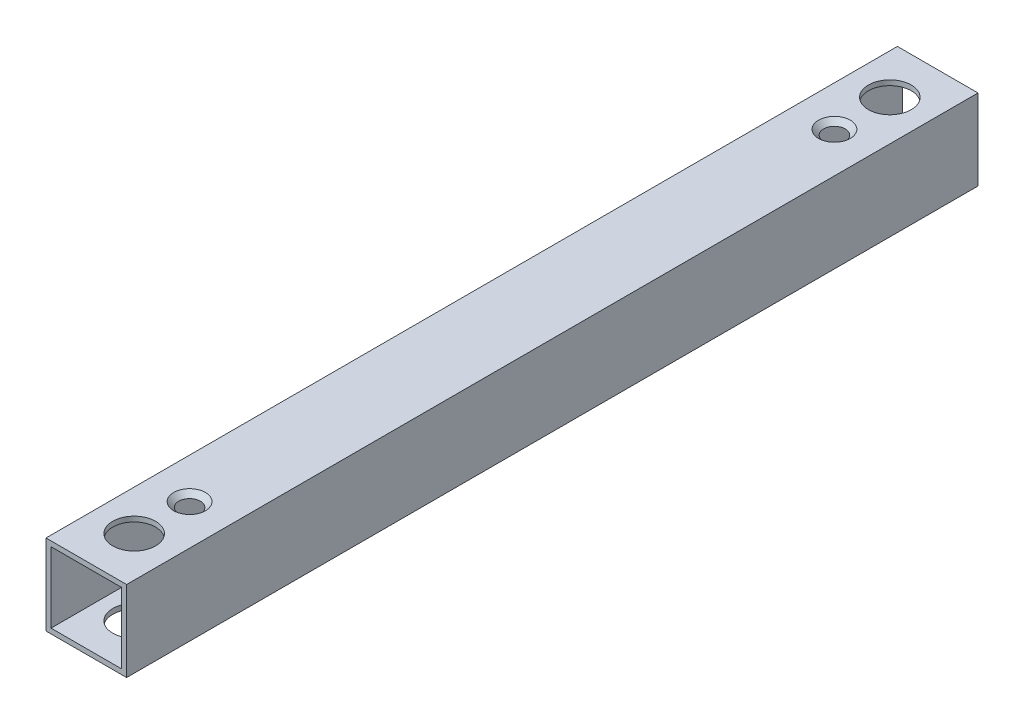
from build123d import *

# Parameters (mm, degrees)
SKETCH1_W           = 16
SKETCH1_H           = 16
SKETCH1_W_2         = 14
SKETCH1_H_2         = 14
BOSS_EXTRUDE1_DEPTH = 169
SKETCH2_R           = 4.25
SKETCH2_R_2         = 1.5
CUT_EXTRUDE1_DEPTH  = 170.944108459


# Read off the part's stored shape, not the designer's step: CSK for M3 Flat Head Machine Screw1
with BuildPart() as part:
    # Sketch1 → Boss-Extrude1 (new body)
    with BuildSketch(Plane.XY):
        Rectangle(SKETCH1_W, SKETCH1_H)
        Rectangle(SKETCH1_W_2, SKETCH1_H_2, mode=Mode.SUBTRACT)
    extrude(amount=-BOSS_EXTRUDE1_DEPTH)

    # Sketch2 → Cut-Extrude1 (cut, through all)
    with BuildSketch(Plane(origin=(0, 8, 0), x_dir=(1, 0, 0), z_dir=(0, 1, 0))):
        with Locations(Location((0, 159.5, 0), (0, 0, 270))):
            Circle(SKETCH2_R)
        with Locations(Location((0, 9.5, 0), (0, 0, 270))):
            Circle(SKETCH2_R)
        with Locations(Location((0, 20.5, 0), (0, 0, 270))):
            Circle(SKETCH2_R_2)
        with Locations(Location((0, 148.5, 0), (0, 0, 270))):
            Circle(SKETCH2_R_2)
    extrude(amount=-CUT_EXTRUDE1_DEPTH, mode=Mode.SUBTRACT)

    # CSK for M3 Flat Head Machine Screw1 outl → CSK for M3 Flat Head Machine Screw1 (revolve, cut)
    with BuildSketch(Plane.XY.offset(-148.5)):
        Polygon((1.5, -8), (3.15, -8), (2.15, -7), (1.5, -7), align=None)
        Polygon((3.15, 8), (1.5, 8), (1.5, 7), (2.15, 7), align=None)
    revolve(axis=Axis((0, 0, -148.5), (0, 1, 0)), mode=Mode.SUBTRACT)

    # CSK for M3 Flat Head Machine Screw1 2 ou → CSK for M3 Flat Head Machine Screw1 2 (revolve, cut)
    with BuildSketch(Plane.XY.offset(-20.5)):
        Polygon((1.5, -8), (3.15, -8), (2.15, -7), (1.5, -7), align=None)
        Polygon((3.15, 8), (1.5, 8), (1.5, 7), (2.15, 7), align=None)
    revolve(axis=Axis((0, 0, -20.5), (0, 1, 0)), mode=Mode.SUBTRACT)


solid = part.part
